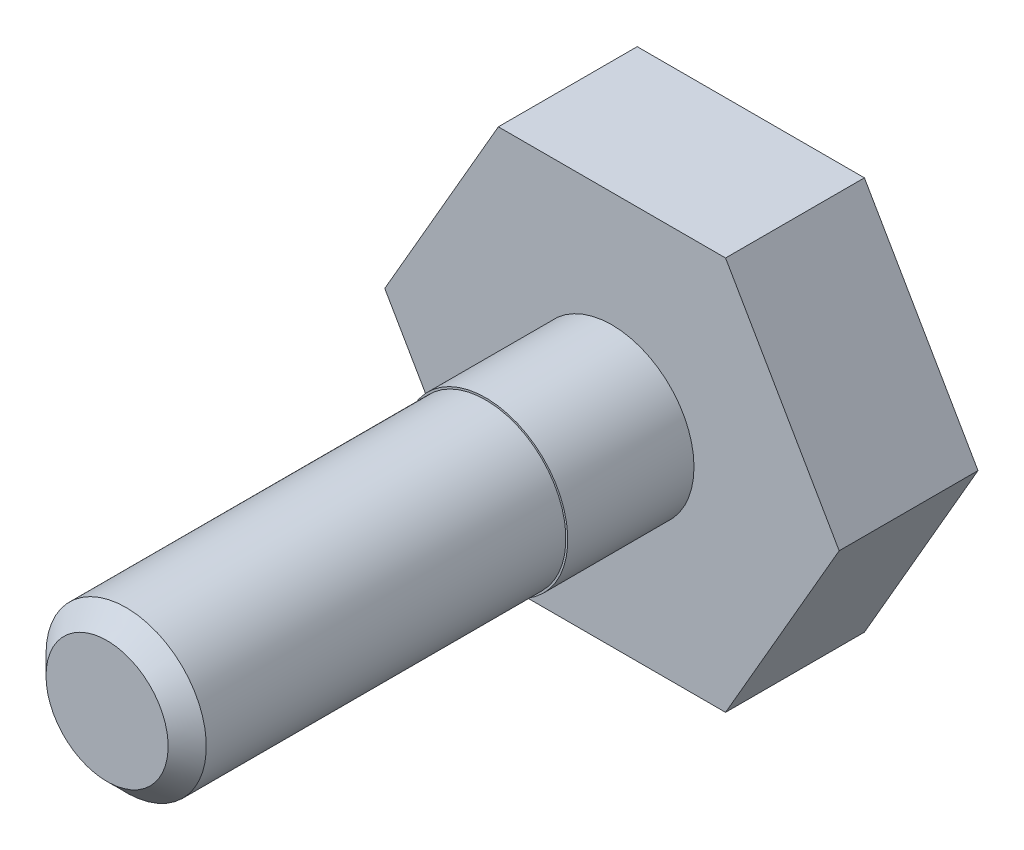
from build123d import *

# Parameters (mm, degrees)
BOSS_EXTRUDE1_DEPTH = 2.75
SKETCH2_R           = 3.25
BOSS_EXTRUDE2_DEPTH = 20


# Read off the part's stored shape, not the designer's step: 1/4-20 Machine Threads Stud1
with BuildPart() as part:
    # Sketch1 → Boss-Extrude1 (new, symmetric)
    with BuildSketch(Plane.XY):
        Polygon((-9, 0), (-4.5, -7.794228634), (4.5, -7.794228634), (9, 0), (4.5, 7.794228634), (-4.5, 7.794228634), align=None)
    extrude(amount=BOSS_EXTRUDE1_DEPTH, both=True)

    # Sketch2 → Boss-Extrude2 (add)
    with BuildSketch(Plane.XY.offset(2.75)):
        Circle(SKETCH2_R)
    extrude(amount=BOSS_EXTRUDE2_DEPTH)

    # 1/4-20 Machine Threads Stud1 outline → 1/4-20 Machine Threads Stud1 (revolve, cut)
    with BuildSketch(Plane.XZ):
        Polygon((3.25, 22.75), (2.41935, 22.75), (3.175, 21.99435), (3.175, 7.75), (3.25, 7.75), align=None)
    revolve(axis=Axis((0, 0, 0), (0, 0, 1)), mode=Mode.SUBTRACT)


solid = part.part
